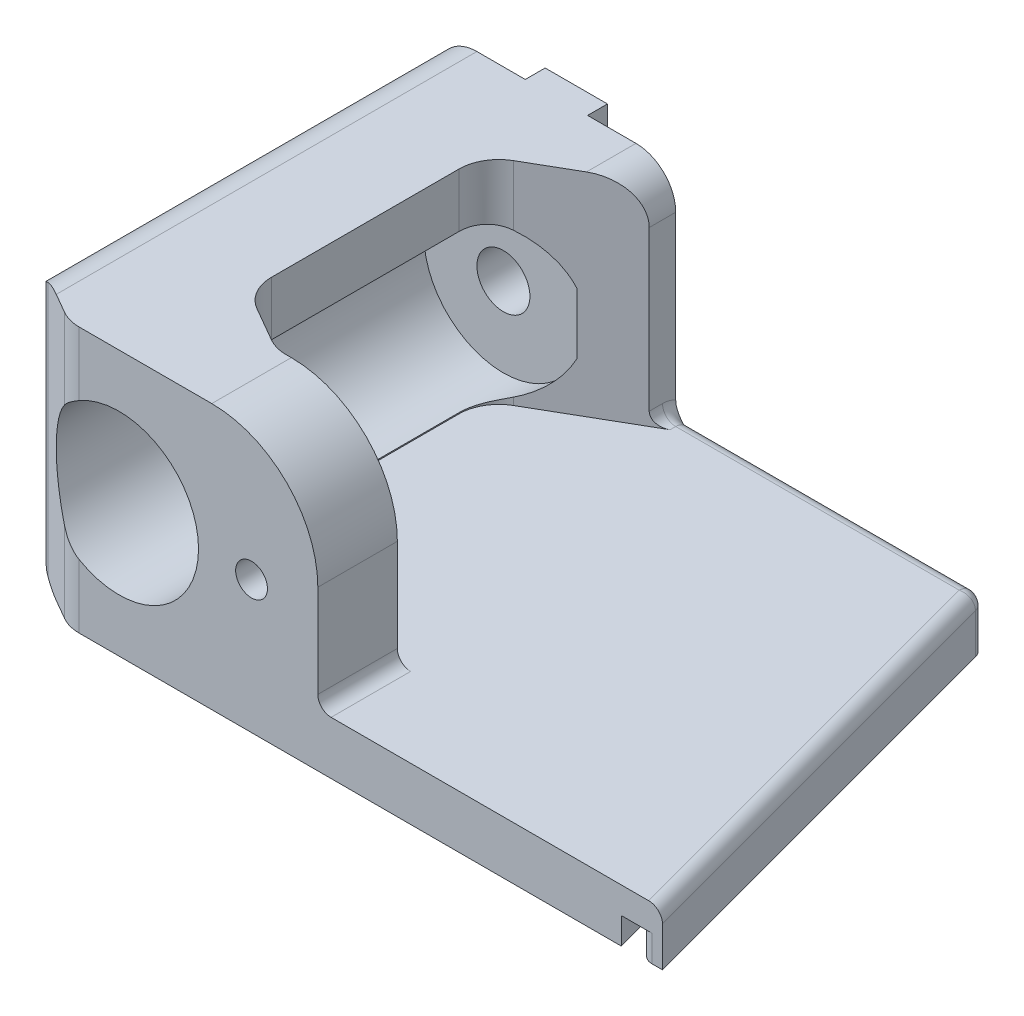
from build123d import *

# Parameters (mm, degrees)
BOSS_EXTRU_1_DEPTH           = 10
ENL_V_MAT_EXTRU_1_DEPTH      = 29.854594898
ENL_V_MAT_EXTRU_1_DEPTH_BACK = 29.854594898
ESQUISSE2_R                  = 2
ENL_V_START                  = 4
ESQUISSE3_R                  = 6
ENL_V_MAT_EXTRU_2_DEPTH      = 25.390139133
BOSS_EXTRU_2_REACH           = 35.257
ENL_V_START_2                = -20
ESQUISSE7_R                  = 1.2
ESQUISSE7_R_2                = 6
ENL_V_MAT_EXTRU_4_DEPTH      = 20
CONG_1_START                 = -10
CONG_1_DEPTH                 = 20
CONG_1_2_DEPTH               = 20
CONG_1_3_DEPTH               = 4.545644043
CONG_1_START_2               = 5.454355957
CONG_1_4_DEPTH               = 4.545644043
CONG_1_START_3               = -7
CONG_1_5_DEPTH               = 14
CONG_1_START_4               = 5.752776733
CONG_1_6_OUTLINE_R           = 6
CONG_1_6_DEPTH               = 28.247223267
CONG_1_START_5               = -1.5
CONG_1_7_DEPTH               = 8.118802154
BOSS_EXTRU_3_DEPTH           = 4
ENL_V_MAT_EXTRU_5_DEPTH      = 2
CONG_2_R                     = 1
CONG_3_R                     = 1
ENL_V_START_3                = -3
ENL_V_MAT_EXTRU_6_DEPTH      = 6
CONG_4_R                     = 8


with BuildPart() as part:
    # Esquisse1 → Boss.-Extru.1 (new, symmetric)
    with BuildSketch(Plane(origin=(0, 0, 0), x_dir=(1, 0, 0), z_dir=(0, 1, 0))):
        Polygon((2.35, 0), (9, 0), (9, -2), (1, -6.618802154), (1, -25), (-9, -25), (-9, 0), (-2.35, 0), (-2.35, 1.5), (2.35, 1.5), align=None)
    extrude(amount=BOSS_EXTRU_1_DEPTH, both=True)

    # Esquisse2 → Enlèv. mat.-Extru.1 (cut, two sides: drawn at the far end of the back side and taken through both)
    with BuildSketch(Plane(origin=(-1.372446517, 0, 0), x_dir=(1, 0, 0), z_dir=(0, 0, 1)).offset(-ENL_V_MAT_EXTRU_1_DEPTH_BACK)):
        with Locations((1.372446517, 0)):
            Circle(ESQUISSE2_R)
    extrude(amount=ENL_V_MAT_EXTRU_1_DEPTH + ENL_V_MAT_EXTRU_1_DEPTH_BACK, mode=Mode.SUBTRACT)

    # Esquisse3 → Enlèv. mat.-Extru.2 (cut, through all)
    with BuildSketch(Plane.XY.offset(ENL_V_START)):
        Circle(ESQUISSE3_R)
    extrude(amount=ENL_V_MAT_EXTRU_2_DEPTH, mode=Mode.SUBTRACT)

    # Boss.-Extru.2: up to this face of the body (flat: up to its plane)
    boss_extru_2_end = Plane(part.part.faces().sort_by_distance((-2.923443816, -10, 10.980550797))[0])
    # Esquisse6 → Boss.-Extru.2 (add, up to the picked face)
    with BuildSketch(Plane(origin=(0, 10, 0), x_dir=(1, 0, 0), z_dir=(0, 1, 0)), mode=Mode.PRIVATE) as boss_extru_2_sk1:
        Polygon((-9, -18.452994616), (5.803847577, -27), (15, -27), (15, -33), (-3.803847577, -33), (-9, -30), align=None)
    boss_extru_2_tool1 = split(extrude(boss_extru_2_sk1.sketch, amount=-BOSS_EXTRU_2_REACH, mode=Mode.PRIVATE), bisect_by=boss_extru_2_end, keep=Keep.BOTH, mode=Mode.PRIVATE)
    add(boss_extru_2_tool1.solids().sort_by(Axis((1.160347, 10, 28.066771), (0, -1, 0)))[0])

    # Esquisse7 → Enlèv. mat.-Extru.4 (cut)
    with BuildSketch(Plane.XY.offset(33).offset(ENL_V_START_2)):
        with Locations((10, 0)):
            Circle(ESQUISSE7_R)
        with Locations(Location((0, 0, 0), (0, 0, 230.656026391))):
            Circle(ESQUISSE7_R_2)
    extrude(amount=ENL_V_MAT_EXTRU_4_DEPTH, mode=Mode.SUBTRACT)

    # Congé1: read off the stored shape, not the designer's step
    # Congé1 outline → Congé1 (cut)
    with BuildSketch(Plane(origin=(0, 0, 0), x_dir=(1, 0, 0), z_dir=(0, 1, 0)).offset(CONG_1_START)):
        with BuildLine():
            Line((-9, -30), (-7.5, -30.866025404))
            ThreePointArc((-7.5, -30.866025404), (-8.598076211, -29.767949192), (-9, -28.267949192))
            Line((-9, -28.267949192), (-9, -30))
        make_face()
    extrude(amount=CONG_1_DEPTH, mode=Mode.SUBTRACT)

    # Cong_1 2 outline → Cong_1 2 (cut)
    with BuildSketch(Plane(origin=(0, 0, 0), x_dir=(1, 0, 0), z_dir=(0, 1, 0)).offset(CONG_1_START)):
        with BuildLine():
            Line((-3.803847577, -33), (-3, -33))
            ThreePointArc((-3, -33), (-3.776457135, -32.897777479), (-4.5, -32.598076211))
            Line((-4.5, -32.598076211), (-3.803847577, -33))
        make_face()
    extrude(amount=CONG_1_2_DEPTH, mode=Mode.SUBTRACT)

    # Cong_1 3 outline → Cong_1 3 (add)
    with BuildSketch(Plane(origin=(0, 0, 0), x_dir=(1, 0, 0), z_dir=(0, 1, 0)).offset(CONG_1_START)):
        with BuildLine():
            Line((5.803847577, -27), (6.607695155, -27))
            ThreePointArc((6.607695155, -27), (5.83123802, -26.897777479), (5.107695155, -26.598076211))
            Line((5.107695155, -26.598076211), (5.803847577, -27))
        make_face()
        with BuildLine():
            Line((1, -6.618802154), (1, -8.350852961))
            ThreePointArc((1, -8.350852961), (1.401923789, -6.850852961), (2.5, -5.75277675))
            Line((2.5, -5.75277675), (1, -6.618802154))
        make_face()
        with BuildLine():
            Line((1, -24.226497308), (2.5, -25.092522712))
            ThreePointArc((2.5, -25.092522712), (1.401923789, -23.994446501), (1, -22.494446501))
            Line((1, -22.494446501), (1, -24.226497308))
        make_face()
    extrude(amount=CONG_1_3_DEPTH)

    # Cong_1 4 outline → Cong_1 4 (add)
    with BuildSketch(Plane(origin=(0, 0, 0), x_dir=(1, 0, 0), z_dir=(0, 1, 0)).offset(CONG_1_START_2)):
        with BuildLine():
            Line((5.803847577, -27), (6.607695155, -27))
            ThreePointArc((6.607695155, -27), (5.83123802, -26.897777479), (5.107695155, -26.598076211))
            Line((5.107695155, -26.598076211), (5.803847577, -27))
        make_face()
        with BuildLine():
            Line((1, -6.618802154), (1, -8.350852961))
            ThreePointArc((1, -8.350852961), (1.401923789, -6.850852961), (2.5, -5.75277675))
            Line((2.5, -5.75277675), (1, -6.618802154))
        make_face()
        with BuildLine():
            Line((1, -24.226497308), (2.5, -25.092522712))
            ThreePointArc((2.5, -25.092522712), (1.401923789, -23.994446501), (1, -22.494446501))
            Line((1, -22.494446501), (1, -24.226497308))
        make_face()
    extrude(amount=CONG_1_4_DEPTH)

    # Cong_1 5 outline → Cong_1 5 (add)
    with BuildSketch(Plane(origin=(0, 0, 0), x_dir=(1, 0, 0), z_dir=(0, 1, 0)).offset(CONG_1_START_3)):
        with BuildLine():
            Line((5.803847577, -27), (6.607695155, -27))
            ThreePointArc((6.607695155, -27), (5.83123802, -26.897777479), (5.107695155, -26.598076211))
            Line((5.107695155, -26.598076211), (5.803847577, -27))
        make_face()
    extrude(amount=CONG_1_5_DEPTH)

    # Cong_1 6 outline → Cong_1 6 (cut)
    with BuildSketch(Plane.XY.offset(CONG_1_START_4)):
        with BuildLine():
            Line((-9, 10), (-9, 7))
            ThreePointArc((-9, 7), (-8.121320344, 9.121320344), (-6, 10))
            Line((-6, 10), (-9, 10))
        make_face()
        with BuildLine():
            ThreePointArc((-6, -10), (-8.121320344, -9.121320344), (-9, -7))
            Line((-9, -7), (-9, -10))
            Line((-9, -10), (-6, -10))
        make_face()
        with BuildLine():
            Line((15, -10), (15, -7))
            ThreePointArc((15, -7), (14.121320344, -9.121320344), (12, -10))
            Line((12, -10), (15, -10))
        make_face()
        Circle(CONG_1_6_OUTLINE_R)
    extrude(amount=CONG_1_6_DEPTH, mode=Mode.SUBTRACT)

    # Cong_1 7 outline → Cong_1 7 (cut)
    with BuildSketch(Plane.XY.offset(CONG_1_START_5)):
        with BuildLine():
            Line((-9, 10), (-9, 7))
            ThreePointArc((-9, 7), (-8.121320344, 9.121320344), (-6, 10))
            Line((-6, 10), (-9, 10))
        make_face()
        with BuildLine():
            ThreePointArc((-6, -10), (-8.121320344, -9.121320344), (-9, -7))
            Line((-9, -7), (-9, -10))
            Line((-9, -10), (-6, -10))
        make_face()
        with BuildLine():
            Line((9, 10), (6, 10))
            ThreePointArc((6, 10), (8.121320344, 9.121320344), (9, 7))
            Line((9, 7), (9, 10))
        make_face()
        with BuildLine():
            ThreePointArc((9, -7), (8.121320344, -9.121320344), (6, -10))
            Line((6, -10), (9, -10))
            Line((9, -10), (9, -7))
        make_face()
    extrude(amount=CONG_1_7_DEPTH, mode=Mode.SUBTRACT)

    # Esquisse8 → Boss.-Extru.3 (add)
    with BuildSketch(Plane.XZ.offset(10)):
        Polygon((-2.35, 0), (32.15767665, 0), (41, 33), (-2.35, 33), align=None)
    extrude(amount=-BOSS_EXTRU_3_DEPTH)

    # Esquisse9 → Enlèv. mat.-Extru.5 (cut)
    with BuildSketch(Plane.XZ.offset(10)):
        Polygon((-9, 1.5), (29.453771897, 1.5), (37.894171459, 33), (39.447085729, 33), (30.202838591, -1.5), (-9, -1.5), align=None)
    extrude(amount=-ENL_V_MAT_EXTRU_5_DEPTH, mode=Mode.SUBTRACT)

    # Congé2
    cong_2_edges = [part.edges().sort_by_distance(p)[0] for p in [
        (39.447085729, -9, 33),
        (29.453771897, -9, 1.5),
        (32.15767665, -8, 0),
        (36.578838325, -6, 16.5),
        (15, -6, 30),
        (20.578838325, -6, 0),
    ]]
    fillet(cong_2_edges, radius=CONG_2_R)

    # Congé3
    cong_3_edges = [part.edges().sort_by_distance(p)[0] for p in [
        (9, -6, 1.5),
        (9, -6.292893219, 0.292893219),
    ]]
    fillet(cong_3_edges, radius=CONG_3_R)

    # Esquisse10 → Enlèv. mat.-Extru.6 (cut)
    with BuildSketch(Plane.XY.offset(33).offset(ENL_V_START_3)):
        Polygon((12.75, 1.58771324), (10, 3.175426481), (7.25, 1.58771324), (7.25, -1.58771324), (10, -3.175426481), (12.75, -1.58771324), align=None)
    extrude(amount=-ENL_V_MAT_EXTRU_6_DEPTH, mode=Mode.SUBTRACT)

    # Congé4
    cong_4_edges = [part.edges().sort_by_distance(p)[0] for p in [
        (15, 10, 30),
    ]]
    fillet(cong_4_edges, radius=CONG_4_R)


solid = part.part
